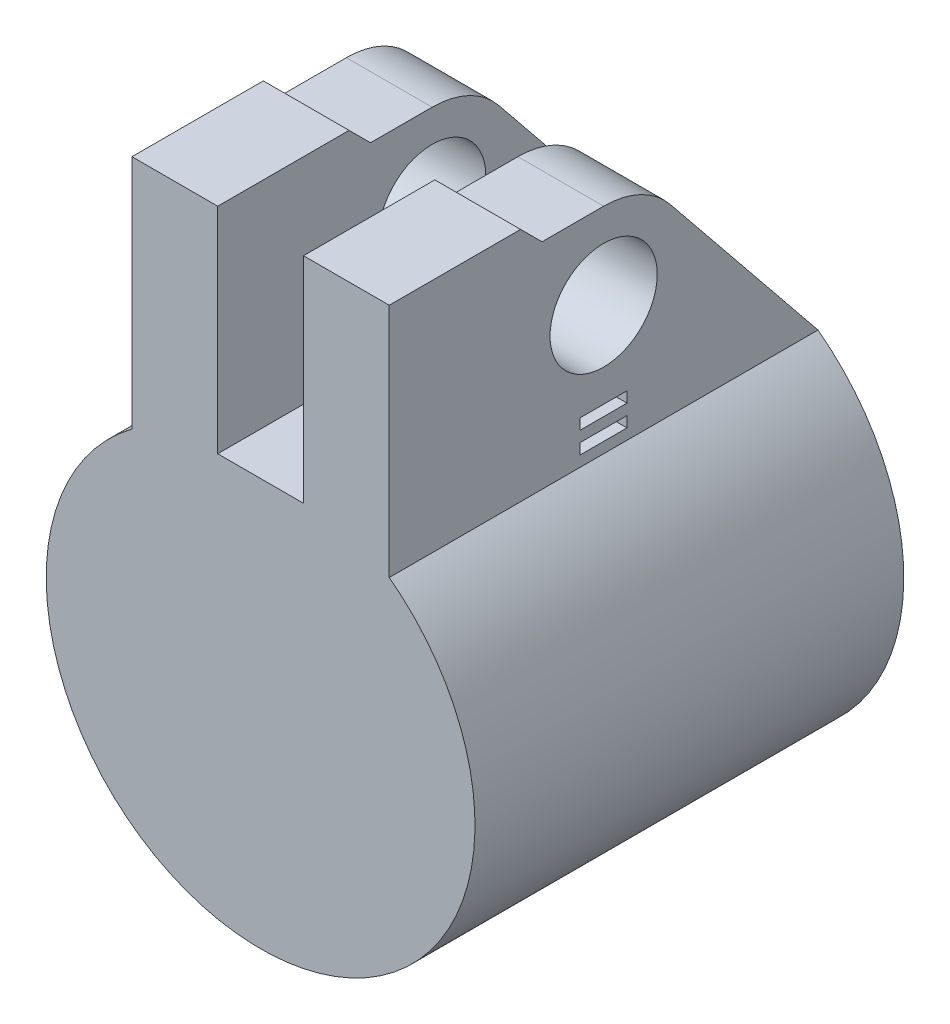
from build123d import *

# Parameters (mm, degrees)
BOSS_EXTRUDE2_DEPTH     = 25.4
SKETCH5_W               = 15.24
SKETCH5_H               = 25.4
BOSS_EXTRUDE3_DEPTH     = 12.7
SKETCH7_W               = 5.08
SKETCH7_H               = 25.4
CUT_EXTRUDE1_DEPTH      = 11.43
SKETCH8_R               = 3.175
CUT_EXTRUDE2_DEPTH      = 17.018
SKETCH9_R               = 2.54
CUT_EXTRUDE3_DEPTH      = 105.993449126
SKETCH10_W              = 5.08
SKETCH10_H              = 9.050505722
BOSS_EXTRUDE4_DEPTH     = 1.27
CHAMFER1_SIZE           = 1.27
CUT_EXTRUDE4_DEPTH      = 2.54
CUT_EXTRUDE4_DEPTH_BACK = 2.54
SKETCH12_W              = 2.770836572
SKETCH12_H              = 0.635
CUT_EXTRUDE5_DEPTH      = 51.805574613


with BuildPart() as part:
    # Sketch1 → Boss-Extrude2 (new body)
    with BuildSketch(Plane.XY):
        with BuildLine():
            Line((-93.89579229, 25.057477651), (-78.65579229, 25.057477651))
            ThreePointArc((-78.65579229, 25.057477651), (-86.27579229, 2.197477651), (-93.89579229, 25.057477651))
        make_face()
    extrude(amount=BOSS_EXTRUDE2_DEPTH)

    # Sketch5 → Boss-Extrude3 (add)
    with BuildSketch(Plane(origin=(0, 25.057477651, 0), x_dir=(1, 0, 0), z_dir=(0, 1, 0))):
        with Locations((-86.27579229, -12.7)):
            Rectangle(SKETCH5_W, SKETCH5_H)
    extrude(amount=BOSS_EXTRUDE3_DEPTH)

    # Sketch7 → Cut-Extrude1 (cut)
    with BuildSketch(Plane(origin=(0, 37.757477651, 0), x_dir=(1, 0, 0), z_dir=(0, 1, 0))):
        with Locations((-86.27579229, -12.7)):
            Rectangle(SKETCH7_W, SKETCH7_H)
    extrude(amount=-CUT_EXTRUDE1_DEPTH, mode=Mode.SUBTRACT)

    # Sketch8 → Cut-Extrude2 (cut)
    with BuildSketch(Plane(origin=(-78.65579229, 0, 0), x_dir=(0, 0, -1), z_dir=(1, 0, 0))):
        with Locations((-12.7, 32.677477651)):
            Circle(SKETCH8_R)
        with BuildLine():
            Line((-12.7, 37.757477651), (0, 37.757477651))
            Line((0, 37.757477651), (0, 25.057477651))
            Line((0, 25.057477651), (-8.750796536, 35.872816757))
            ThreePointArc((-8.750796536, 35.872816757), (-10.512069775, 37.262165353), (-12.7, 37.757477651))
        make_face()
    extrude(amount=-CUT_EXTRUDE2_DEPTH, mode=Mode.SUBTRACT)

    # Sketch9 → Cut-Extrude3 (cut, through all)
    with BuildSketch(Plane(origin=(0, 26.327477651, 0), x_dir=(1, 0, 0), z_dir=(0, 1, 0))):
        with Locations(Location((-86.27579229, -12.7, 0), (0, 0, 270))):
            Circle(SKETCH9_R)
    extrude(amount=-CUT_EXTRUDE3_DEPTH, mode=Mode.SUBTRACT)

    # Sketch10 → Boss-Extrude4 (add)
    with BuildSketch(Plane(origin=(0, 37.757477651, 0), x_dir=(1, 0, 0), z_dir=(0, 1, 0))):
        with Locations((-91.35579229, -20.874747139)):
            Rectangle(SKETCH10_W, SKETCH10_H)
        with Locations((-81.19579229, -20.874747139)):
            Rectangle(SKETCH10_W, SKETCH10_H)
    extrude(amount=BOSS_EXTRUDE4_DEPTH)

    # Chamfer1
    chamfer1_edges = [part.edges().sort_by_distance(p)[0] for p in [
        (-81.19579229, 39.027477651, 16.349494278),
        (-91.35579229, 39.027477651, 16.349494278),
    ]]
    chamfer(chamfer1_edges, length=CHAMFER1_SIZE - 0.0001)  # a hair under: the kernel refuses the full size

    # Sketch11 → Cut-Extrude4 (cut, two sides: drawn at the far end of the back side and taken through both)
    with BuildSketch(Plane.XY.offset(12.7).offset(-CUT_EXTRUDE4_DEPTH_BACK)):
        with BuildLine():
            Line((-88.81579229, 26.327477651), (-93.000878218, 4.124213556))
            ThreePointArc((-93.000878218, 4.124213556), (-86.27579229, 2.197477651), (-79.550706362, 4.124213556))
            Line((-79.550706362, 4.124213556), (-83.73579229, 26.327477651))
            Line((-83.73579229, 26.327477651), (-88.81579229, 26.327477651))
        make_face()
    extrude(amount=CUT_EXTRUDE4_DEPTH + CUT_EXTRUDE4_DEPTH_BACK, mode=Mode.SUBTRACT)

    # Sketch12 → Cut-Extrude5 (cut, through all)
    with BuildSketch(Plane(origin=(-78.65579229, 0, 0), x_dir=(0, 0, -1), z_dir=(1, 0, 0))):
        with Locations((-12.7, 26.009977651)):
            Rectangle(SKETCH12_W, SKETCH12_H)
        with Locations((-12.7, 27.279977651)):
            Rectangle(SKETCH12_W, SKETCH12_H)
    extrude(amount=-CUT_EXTRUDE5_DEPTH, mode=Mode.SUBTRACT)


solid = part.part
